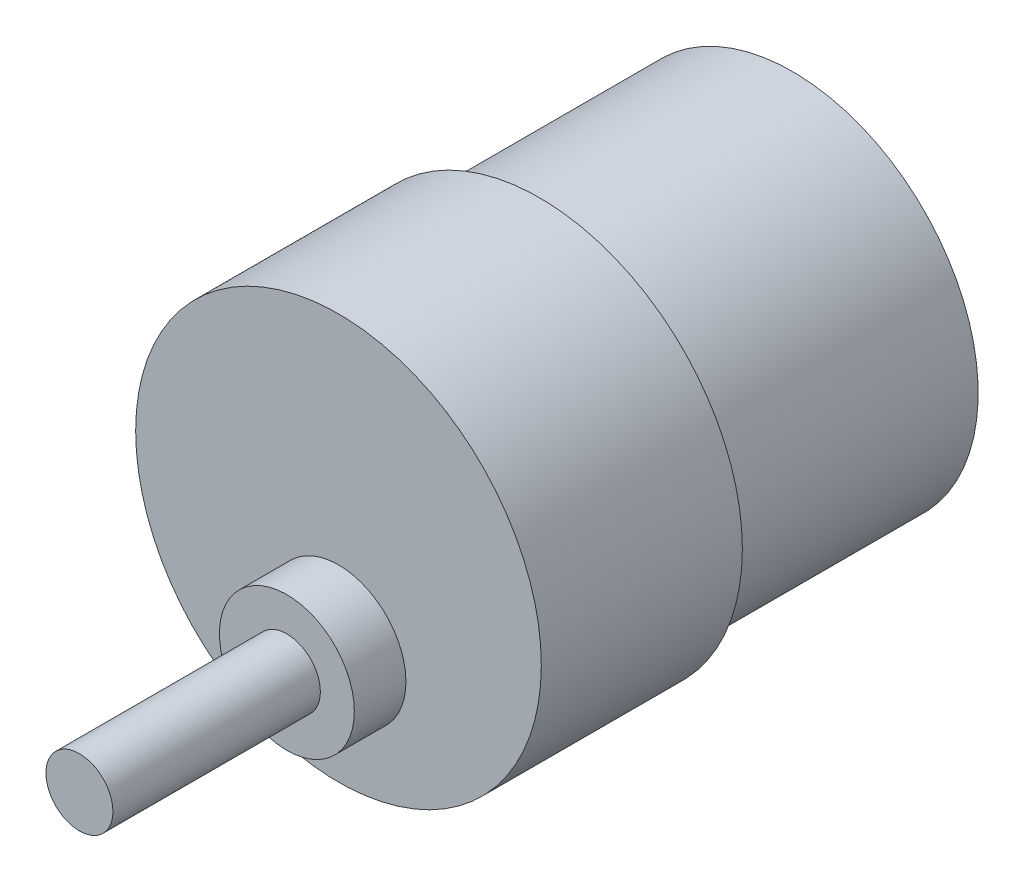
from build123d import *

# Parameters (mm, degrees)
SKETCH1_R           = 16.5735
BOSS_EXTRUDE1_DEPTH = 22.606
SKETCH2_R           = 18.11655
BOSS_EXTRUDE2_DEPTH = 17.9578
SKETCH3_R           = 6.02615
BOSS_EXTRUDE3_DEPTH = 4.6101
SKETCH5_R           = 2.99085
BOSS_EXTRUDE4_DEPTH = 18.5293


with BuildPart() as part:
    # Sketch1 → Boss-Extrude1 (new body)
    with BuildSketch(Plane.XY):
        Circle(SKETCH1_R)
    extrude(amount=BOSS_EXTRUDE1_DEPTH)

    # Sketch2 → Boss-Extrude2 (add)
    with BuildSketch(Plane.XY.offset(22.606)):
        Circle(SKETCH2_R)
    extrude(amount=BOSS_EXTRUDE2_DEPTH)

    # Sketch3 → Boss-Extrude3 (add)
    with BuildSketch(Plane.XY.offset(40.5638)):
        with Locations((0, -7.3279)):
            Circle(SKETCH3_R)
    extrude(amount=BOSS_EXTRUDE3_DEPTH)

    # Sketch5 → Boss-Extrude4 (add)
    with BuildSketch(Plane.XY.offset(45.1739)):
        with Locations((0, -7.3279)):
            Circle(SKETCH5_R)
    extrude(amount=BOSS_EXTRUDE4_DEPTH)


solid = part.part
